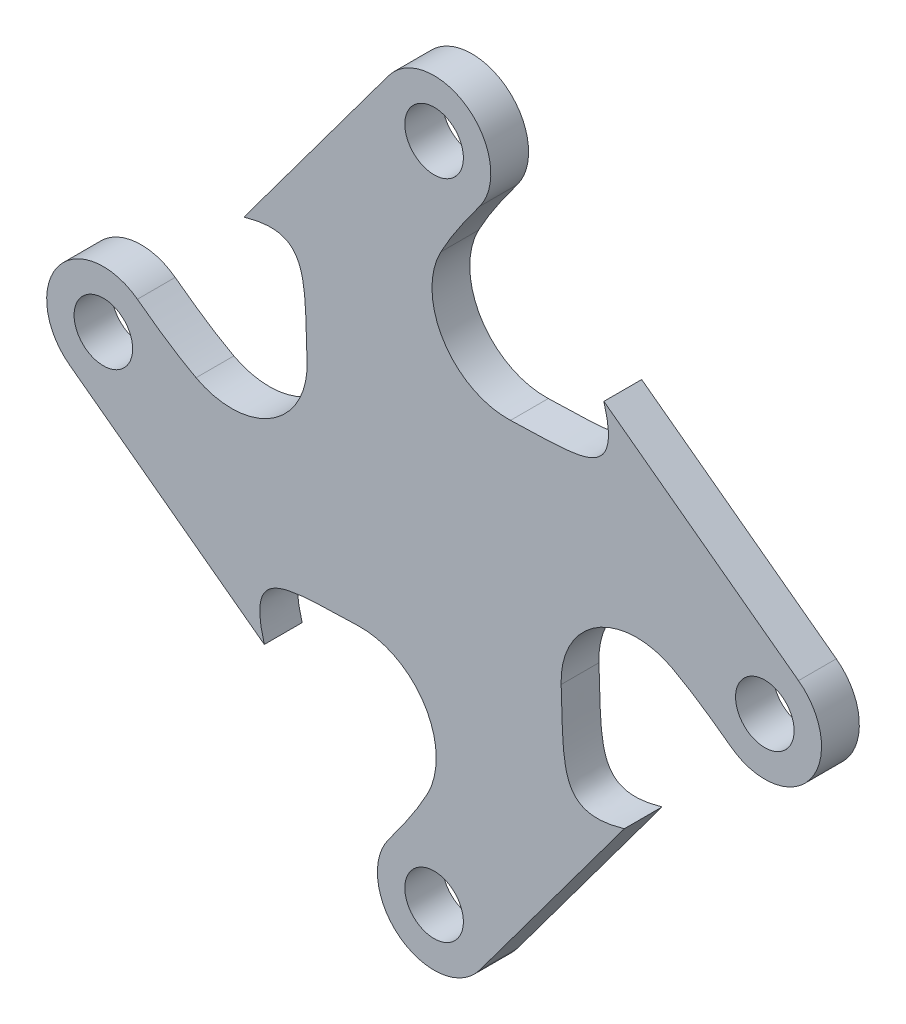
from build123d import *

# Parameters (mm, degrees)
SZKIC1_R                    = 3
SZKIC1_R_2                  = 6
DODANIE_WYCI_GNI_CIE1_DEPTH = 2
SZYK_KO_OWY1_COUNT          = 4
ZAOKR_GLENIE1_DEPTH         = 2
SZKIC2_R                    = 1.55
WYTNIJ_WYCI_GNI_CIE1_DEPTH  = 30.060282321


with BuildPart() as part:
    # Szkic1 → Dodanie-wyciągnięcie1 (new body)
    with BuildSketch(Plane.XY):
        with BuildLine():
            ThreePointArc((2.400147918, 15.700197241), (-1.790710564, 15.093060932), (-2.413695775, 19.281592745))
            Line((-2.413695775, 19.281592745), (-10.062410419, 8.983603822))
            add(Edge.make_bspline(
                [(-10.062410419, 8.983603822), (-4.760498221, 10.518777319), (-8.176009399, 4.470768002), (-5.592129953, -2.174415459)],
                knots=[0, 0, 0, 0, 1, 1, 1, 1], degree=3))
            ThreePointArc((-5.592129953, -2.174415459), (-3.27017187, 5.030504541), (4.257024291, 4.228208153))
            add(Edge.make_bspline(
                [(4.257024291, 4.228208153), (0.108817482, 8.404685875), (-2.964269427, 8.546416052), (2.400147918, 15.700197241)],
                knots=[0, 0, 0, 0, 1, 1, 1, 1], degree=3))
        make_face()
        with Locations((0, 17.5)):
            Circle(SZKIC1_R)
        Circle(SZKIC1_R_2)
    dodanie_wyci_gni_cie1 = extrude(amount=DODANIE_WYCI_GNI_CIE1_DEPTH)

    # Szyk kołowy1: Dodanie-wyciągnięcie1 ×4 about axis
    szyk_ko_owy1_axis = Axis((0, 0, 0), (0, 0, -1))
    for i in range(1, SZYK_KO_OWY1_COUNT):
        add(dodanie_wyci_gni_cie1.rotate(szyk_ko_owy1_axis, i * 360 / SZYK_KO_OWY1_COUNT))

    # Zaokrąglenie1: read off the stored shape, not the designer's step
    # Zaokrąglenie1 outline → Zaokrąglenie1 (add)
    with BuildSketch(Plane.XY):
        with BuildLine():
            add(Edge.make_bspline(
                [(-6.722543952, 4.044752518), (-6.693847694, 3.317092727), (-6.646227592, 2.537215945), (-6.544838162, 1.721663177)],
                knots=[0.664728108, 0.664728108, 0.664728108, 0.664728108, 0.79801197, 0.79801197, 0.79801197, 0.79801197], degree=3))
            ThreePointArc((-6.722543952, 4.044752518), (-8.59130438, 0.500235564), (-12.595628187, 0.354438378))
            add(Edge.make_bspline(
                [(-6.544838162, 1.721663177), (-8.318139153, -0.279379709), (-9.515072999, -1.281625971), (-12.595628187, 0.354438378)],
                knots=[0.223227171, 0.223227171, 0.223227171, 0.223227171, 0.829356845, 0.829356845, 0.829356845, 0.829356845], degree=3))
        make_face()
        with BuildLine():
            add(Edge.make_bspline(
                [(-4.044752518, -6.722543952), (-3.317092725, -6.693847694), (-2.537215942, -6.646227592), (-1.721663172, -6.544838162)],
                knots=[0.664728108, 0.664728108, 0.664728108, 0.664728108, 0.79801197, 0.79801197, 0.79801197, 0.79801197], degree=3))
            ThreePointArc((-4.044752518, -6.722543952), (-0.500235564, -8.59130438), (-0.354438378, -12.595628187))
            add(Edge.make_bspline(
                [(-1.721663172, -6.544838162), (0.279379709, -8.318139153), (1.281625971, -9.515072999), (-0.354438378, -12.595628187)],
                knots=[0.223227171, 0.223227171, 0.223227171, 0.223227171, 0.829356845, 0.829356845, 0.829356845, 0.829356845], degree=3))
        make_face()
        with BuildLine():
            add(Edge.make_bspline(
                [(6.722543952, -4.044752518), (6.693847694, -3.317092727), (6.646227592, -2.537215945), (6.544838162, -1.721663177)],
                knots=[0.664728108, 0.664728108, 0.664728108, 0.664728108, 0.79801197, 0.79801197, 0.79801197, 0.79801197], degree=3))
            ThreePointArc((6.722543952, -4.044752518), (8.59130438, -0.500235564), (12.595628187, -0.354438378))
            add(Edge.make_bspline(
                [(6.544838162, -1.721663177), (8.318139153, 0.279379709), (9.515072999, 1.281625971), (12.595628187, -0.354438378)],
                knots=[0.223227171, 0.223227171, 0.223227171, 0.223227171, 0.829356845, 0.829356845, 0.829356845, 0.829356845], degree=3))
        make_face()
        with BuildLine():
            add(Edge.make_bspline(
                [(4.044752518, 6.722543952), (3.317092727, 6.693847694), (2.537215945, 6.646227592), (1.721663177, 6.544838162)],
                knots=[0.664728108, 0.664728108, 0.664728108, 0.664728108, 0.79801197, 0.79801197, 0.79801197, 0.79801197], degree=3))
            ThreePointArc((4.044752518, 6.722543952), (0.500235564, 8.59130438), (0.354438378, 12.595628187))
            add(Edge.make_bspline(
                [(1.721663177, 6.544838162), (-0.279379709, 8.318139153), (-1.281625971, 9.515072999), (0.354438378, 12.595628187)],
                knots=[0.223227171, 0.223227171, 0.223227171, 0.223227171, 0.829356845, 0.829356845, 0.829356845, 0.829356845], degree=3))
        make_face()
    extrude(amount=ZAOKR_GLENIE1_DEPTH)

    # Szkic2 → Wytnij-wyciągnięcie1 (cut, through all)
    with BuildSketch(Plane.XY.offset(2)):
        with Locations((0, 17.5)):
            Circle(SZKIC2_R)
        with Locations((17.5, 0)):
            Circle(SZKIC2_R)
        with Locations((0, -17.5)):
            Circle(SZKIC2_R)
        with Locations((-17.5, 0)):
            Circle(SZKIC2_R)
    extrude(amount=-WYTNIJ_WYCI_GNI_CIE1_DEPTH, mode=Mode.SUBTRACT)


solid = part.part
